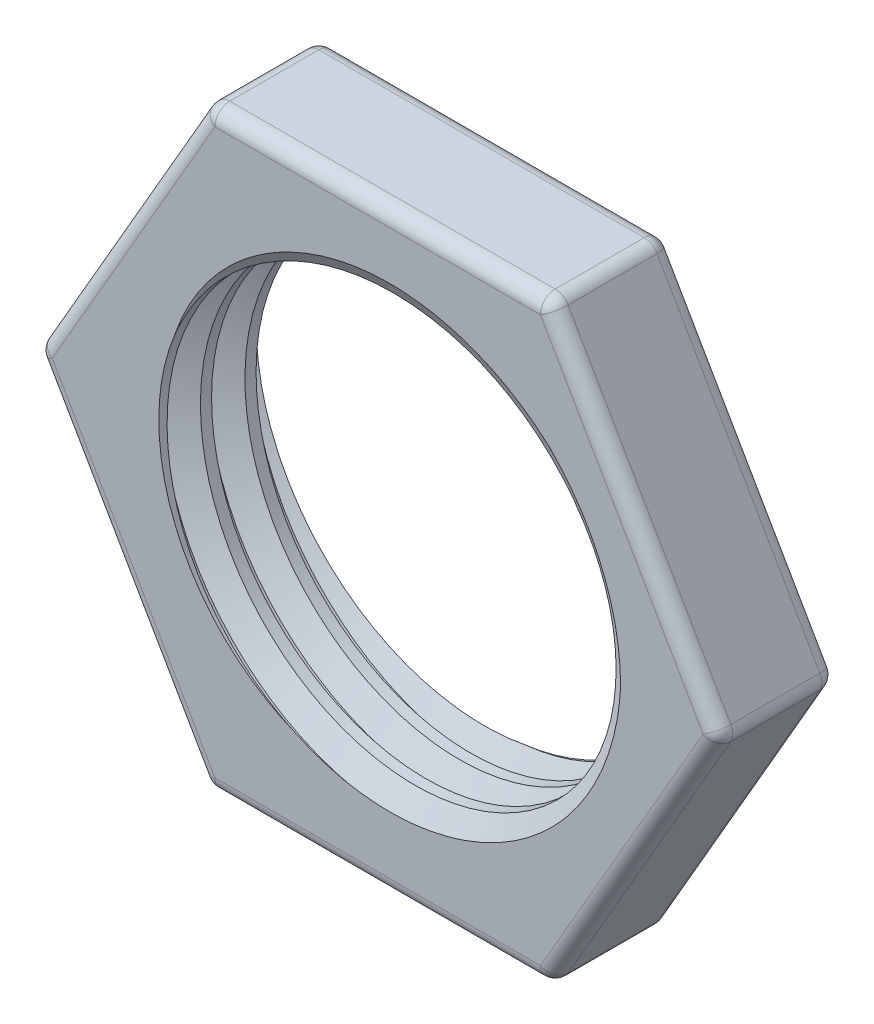
from build123d import *

# Parameters (mm, degrees)
SKIZZE1_R                       = 8.188
AUFSATZ_LINEAR_AUSTRAGEN1_DEPTH = 4
GEWINDE1_PITCH                  = 1.5
SKIZZE7_W                       = 5.280408975
SKIZZE7_H                       = 21.060699533
SKIZZE7_W_2                     = 5.818663971
SKIZZE7_H_2                     = 21.896441579
SCHNITT_LINEAR_AUSTRAGEN1_DEPTH = 26.720766668
VERRUNDUNG1_R                   = 0.5


with BuildPart() as part:
    # Skizze1 → Aufsatz-Linear austragen1 (new body)
    with BuildSketch(Plane.XY):
        Polygon((-11.547005384, 0), (-5.773502692, -10), (5.773502692, -10), (11.547005384, 0), (5.773502692, 10), (-5.773502692, 10), align=None)
        Circle(SKIZZE1_R, mode=Mode.SUBTRACT)
    extrude(amount=AUFSATZ_LINEAR_AUSTRAGEN1_DEPTH)

    # Gewinde1: the profile of Gewindeprofil1 profile screwed along a right-hand helix of 4 turns, 8 arcs to a turn; built about Z, then put on its axis
    gewinde1_z = Axis((0, 0, 0), (0, 0, 1))
    gewinde1_corners = [(8.1883, 0, -0.000173205), (8.1883, 0, 1.312673201), (7.376101188, 0, 0.843749998), (7.376101188, 0, 0.468749998)]
    with BuildLine(mode=Mode.PRIVATE) as gewinde1_profile:
        Line(gewinde1_corners[0], gewinde1_corners[1])
        Line(gewinde1_corners[1], gewinde1_corners[2])
        Line(gewinde1_corners[2], gewinde1_corners[3])
        Line(gewinde1_corners[3], gewinde1_corners[0])
    gewinde1_cap = Face(gewinde1_profile.wire())
    gewinde1_turn_angles = [0, 22.5, 45, 67.5, 90, 112.5, 135, 157.5, 180, 202.5, 225, 247.5, 270, 292.5, 315, 337.5, 360]
    gewinde1_turn_weights = [1, 0.9238795325112867, 1, 0.9238795325112867, 1, 0.9238795325112867, 1, 0.9238795325112867, 1, 0.9238795325112867, 1, 0.9238795325112867, 1, 0.9238795325112867, 1, 0.9238795325112867, 1]
    gewinde1_turn_rails = [Edge.make_bspline([Vector(p[0], p[1], 0).rotate(gewinde1_z, gewinde1_turn_angles[k]) / gewinde1_turn_weights[k] + Vector(0, 0, p[2] + GEWINDE1_PITCH * gewinde1_turn_angles[k] / 360) for k in range(17)], [0, 0, 0, 1, 1, 2, 2, 3, 3, 4, 4, 5, 5, 6, 6, 7, 7, 8, 8, 8], 2, gewinde1_turn_weights) for p in gewinde1_corners]
    gewinde1_turn_sides = [Face.make_surface_from_curves(gewinde1_turn_rails[p[0]], gewinde1_turn_rails[p[1]]) for p in [(0, 1), (1, 2), (2, 3), (3, 0)]]
    gewinde1 = Plane(origin=(0, 0, -2), x_dir=(1, 0, 0), z_dir=(0, 0, 1)) * Solid(Shell([*[p.moved(Location((0, 0, GEWINDE1_PITCH * i))) for i in range(4) for p in gewinde1_turn_sides], gewinde1_cap, gewinde1_cap.rotate(gewinde1_z, 1440).moved(Location((0, 0, GEWINDE1_PITCH * 1440 / 360)))]))
    add(gewinde1)

    # Skizze7 → Schnitt-Linear austragen1 (cut, through all)
    with BuildSketch(Plane(origin=(-8.660254038, 5, 0), x_dir=(0, 0, 1), z_dir=(-0.8660254037844415, 0.49999999999999517, 0))):
        with Locations((-2.640204488, 0.585019432)):
            Rectangle(SKIZZE7_W, SKIZZE7_H)
        with Locations((6.909331986, -0.222864546)):
            Rectangle(SKIZZE7_W_2, SKIZZE7_H_2)
    extrude(amount=-SCHNITT_LINEAR_AUSTRAGEN1_DEPTH, mode=Mode.SUBTRACT)

    # Verrundung1
    verrundung1_edges = [part.edges().sort_by_distance(p)[0] for p in [
        (-5.773502692, 10, 2),
        (5.773502692, 10, 2),
        (11.547005384, 0, 2),
        (5.773502692, -10, 2),
        (-5.773502692, -10, 2),
        (-11.547005384, 0, 2),
        (0, -10, 4),
        (8.660254038, -5, 4),
        (8.660254038, 5, 4),
        (0, 10, 4),
        (-8.660254038, 5, 4),
        (0, 10, 0),
        (8.660254038, 5, 0),
        (8.660254038, -5, 0),
        (0, -10, 0),
        (-8.660254038, -5, 0),
        (-8.660254038, 5, 0),
        (-8.660254038, -5, 4),
    ]]
    fillet(verrundung1_edges, radius=VERRUNDUNG1_R)


solid = part.part
